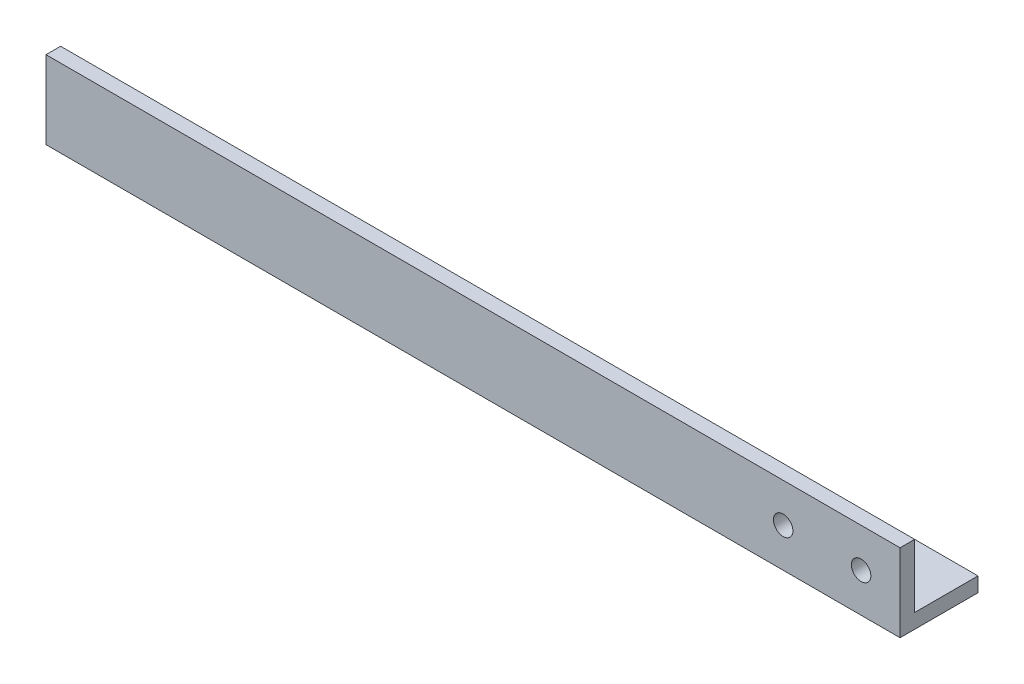
from build123d import *

# Parameters (mm, degrees)
BOSS_EXTRUDE1_DEPTH = 278.384
CUT_EXTRUDE1_REACH  = 282.301
SKETCH2_R           = 3.175
CUT_EXTRUDE2_REACH  = 282.692
SKETCH3_R           = 3.175
CUT_EXTRUDE3_REACH  = 282.692
SKETCH6_R           = 3.175


with BuildPart() as part:
    # Sketch1 → Boss-Extrude1 (new body)
    with BuildSketch(Plane(origin=(0, 0, 0), x_dir=(0, 0, -1), z_dir=(1, 0, 0))):
        Polygon((0, 0), (0, -25.4), (25.4, -25.4), (25.4, -20.6375), (4.7625, -20.6375), (4.7625, 0), align=None)
    extrude(amount=BOSS_EXTRUDE1_DEPTH)

    # Sketch2 → Cut-Extrude1 (cut, up to next)
    with BuildSketch(Plane(origin=(0, -20.6375, 0), x_dir=(1, 0, 0), z_dir=(0, 1, 0)), mode=Mode.PRIVATE) as cut_extrude1_sk1:
        with Locations((9.525, 11.1125)):
            Circle(SKETCH2_R)
    cut_extrude1_tool1 = extrude(cut_extrude1_sk1.sketch, amount=-CUT_EXTRUDE1_REACH, mode=Mode.PRIVATE) & part.part
    # Sketch2 → Cut-Extrude1 (cut, up to next)
    with BuildSketch(Plane(origin=(0, -20.6375, 0), x_dir=(1, 0, 0), z_dir=(0, 1, 0)), mode=Mode.PRIVATE) as cut_extrude1_sk2:
        with Locations((19.05, 17.4625)):
            Circle(SKETCH2_R)
    cut_extrude1_tool2 = extrude(cut_extrude1_sk2.sketch, amount=-CUT_EXTRUDE1_REACH, mode=Mode.PRIVATE) & part.part
    add(cut_extrude1_tool1.solids().sort_by_distance((9.525, -20.6375, -11.1125))[0], mode=Mode.SUBTRACT)
    add(cut_extrude1_tool2.solids().sort_by_distance((19.05, -20.6375, -17.4625))[0], mode=Mode.SUBTRACT)

    # Sketch3 → Cut-Extrude2 (cut, up to next)
    with BuildSketch(Plane.XZ.offset(25.4), mode=Mode.PRIVATE) as cut_extrude2_sk1:
        with Locations((184.095250482, -13.470384182)):
            Circle(SKETCH3_R)
    cut_extrude2_tool1 = extrude(cut_extrude2_sk1.sketch, amount=-CUT_EXTRUDE2_REACH, mode=Mode.PRIVATE) & part.part
    add(cut_extrude2_tool1.solids().sort_by_distance((184.09525, -25.4, -13.470384))[0], mode=Mode.SUBTRACT)

    # Sketch6 → Cut-Extrude3 (cut, up to next)
    with BuildSketch(Plane.XY, mode=Mode.PRIVATE) as cut_extrude3_sk1:
        with Locations((240.284, -12.7)):
            Circle(SKETCH6_R)
    cut_extrude3_tool1 = extrude(cut_extrude3_sk1.sketch, amount=-CUT_EXTRUDE3_REACH, mode=Mode.PRIVATE) & part.part
    # Sketch6 → Cut-Extrude3 (cut, up to next)
    with BuildSketch(Plane.XY, mode=Mode.PRIVATE) as cut_extrude3_sk2:
        with Locations((265.684, -12.7)):
            Circle(SKETCH6_R)
    cut_extrude3_tool2 = extrude(cut_extrude3_sk2.sketch, amount=-CUT_EXTRUDE3_REACH, mode=Mode.PRIVATE) & part.part
    add(cut_extrude3_tool1.solids().sort_by_distance((240.284, -12.7, 0))[0], mode=Mode.SUBTRACT)
    add(cut_extrude3_tool2.solids().sort_by_distance((265.684, -12.7, 0))[0], mode=Mode.SUBTRACT)


solid = part.part
